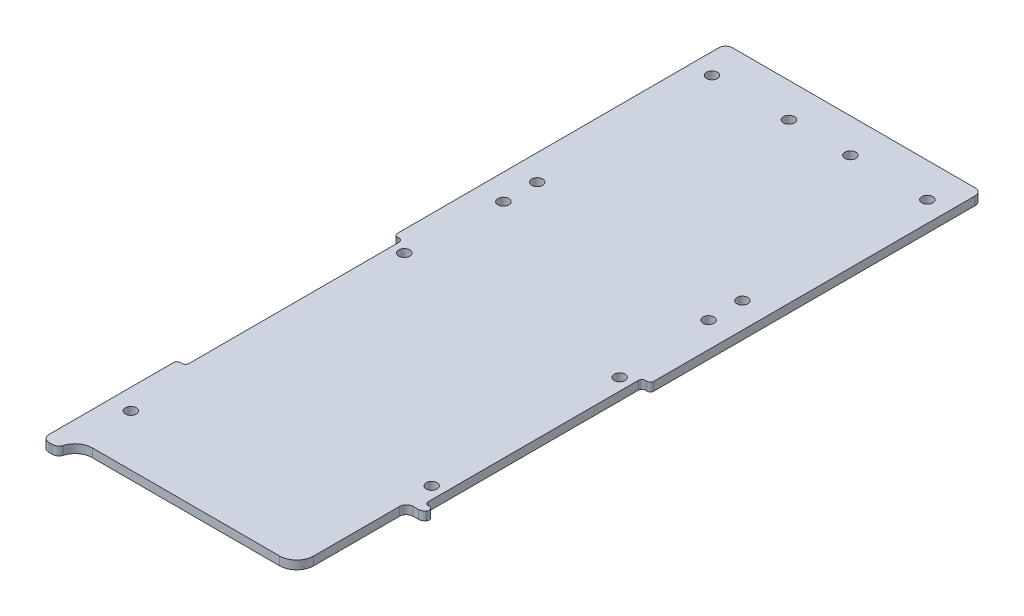
from build123d import *

# Parameters (mm, degrees)
SKETCH1_R               = 2.032
BOSS_EXTRUDE1_DEPTH     = 3.175
FILLET1_R               = 2.54
FILLET2_R               = 2.54
FILLET3_R               = 6.35
CUT_EXTRUDE1_DEPTH      = 136.673215063
FILLET4_R               = 6.35
FILLET5_R               = 2.54
SKETCH3_R               = 2.032
CUT_EXTRUDE2_DEPTH      = 136.673215063
CUT_EXTRUDE3_DEPTH      = 136.673215063
CUT_EXTRUDE3_DEPTH_BACK = 136.673215063
SKETCH4_W               = 3.175
SKETCH4_H               = 80.645
FILLET6_R               = 1.27


with BuildPart() as part:
    # Sketch1 → Boss-Extrude1 (new body)
    with BuildSketch(Plane(origin=(0, 0, 0), x_dir=(1, 0, 0), z_dir=(0, 1, 0))):
        Polygon((47.625, 127), (-47.625, 127), (-47.625, -127), (-41.275, -127), (-41.275, -120.65), (41.275, -120.65), (41.275, -127), (47.625, -127), align=None)
        with Locations((-39.999684148, -101.6)):
            Circle(SKETCH1_R, mode=Mode.SUBTRACT)
        with Locations((39.999684148, -69.85)):
            Circle(SKETCH1_R, mode=Mode.SUBTRACT)
        with Locations((-39.999684148, 0)):
            Circle(SKETCH1_R, mode=Mode.SUBTRACT)
        with Locations((-39.999684148, 114.3)):
            Circle(SKETCH1_R, mode=Mode.SUBTRACT)
        with Locations((-11.424684148, 114.3)):
            Circle(SKETCH1_R, mode=Mode.SUBTRACT)
        with Locations((39.999684148, 0)):
            Circle(SKETCH1_R, mode=Mode.SUBTRACT)
        with Locations((11.424684148, 114.3)):
            Circle(SKETCH1_R, mode=Mode.SUBTRACT)
        with Locations((39.999684148, 114.3)):
            Circle(SKETCH1_R, mode=Mode.SUBTRACT)
    extrude(amount=BOSS_EXTRUDE1_DEPTH)

    # Fillet1
    fillet1_edges = [part.edges().sort_by_distance(p)[0] for p in [
        (-47.625, 1.5875, -127),
        (47.625, 1.5875, -127),
        (47.625, 1.5875, 127),
        (-47.625, 1.5875, 127),
    ]]
    fillet(fillet1_edges, radius=FILLET1_R)

    # Fillet2
    fillet2_edges = [part.edges().sort_by_distance(p)[0] for p in [
        (41.275, 1.5875, 127),
        (-41.275, 1.5875, 127),
    ]]
    fillet(fillet2_edges, radius=FILLET2_R)

    # Fillet3
    fillet3_edges = [part.edges().sort_by_distance(p)[0] for p in [
        (41.275, 1.5875, 120.65),
        (-41.275, 1.5875, 120.65),
    ]]
    fillet(fillet3_edges, radius=FILLET3_R)

    # Sketch2 → Cut-Extrude1 (cut, through all)
    with BuildSketch(Plane.XZ):
        with BuildLine():
            Line((40.64508, 123.578690235), (40.64508, 79.88808))
            Line((40.64508, 79.88808), (47.625, 79.88808))
            Line((47.625, 79.88808), (47.625, 124.46))
            ThreePointArc((47.625, 124.46), (46.881051224, 126.256051224), (45.085, 127))
            Line((45.085, 127), (43.815, 127))
            ThreePointArc((43.815, 127), (42.297059666, 126.496530663), (41.380880287, 125.185714286))
            ThreePointArc((41.380880287, 125.185714286), (41.069166069, 124.356476684), (40.64508, 123.578690235))
        make_face()
    extrude(amount=-CUT_EXTRUDE1_DEPTH, mode=Mode.SUBTRACT)

    # Fillet4
    fillet4_edges = [part.edges().sort_by_distance(p)[0] for p in [
        (40.64508, 1.5875, 123.578690235),
    ]]
    fillet(fillet4_edges, radius=FILLET4_R)

    # Fillet5
    fillet5_edges = [part.edges().sort_by_distance(p)[0] for p in [
        (47.625, 1.5875, 79.88808),
        (40.64508, 1.5875, 79.88808),
    ]]
    fillet(fillet5_edges, radius=FILLET5_R)

    # Sketch3 → Cut-Extrude2 (cut, through all)
    with BuildSketch(Plane.XZ):
        with Locations((-38.106743812, -34.913768806)):
            Circle(SKETCH3_R)
        with Locations((-38.106743812, -47.490173279)):
            Circle(SKETCH3_R)
        with Locations((38.106743812, -47.490173279)):
            Circle(SKETCH3_R)
        with Locations((38.106743812, -34.913768806)):
            Circle(SKETCH3_R)
    extrude(amount=-CUT_EXTRUDE2_DEPTH, mode=Mode.SUBTRACT)

    # Sketch4 → Cut-Extrude3 (cut, two sides: drawn at the far end of the back side and taken through both)
    with BuildSketch(Plane(origin=(0, 3.175, 0), x_dir=(1, 0, 0), z_dir=(0, 1, 0)).offset(-CUT_EXTRUDE3_DEPTH_BACK)):
        with Locations((-46.0375, -36.5125)):
            Rectangle(SKETCH4_W, SKETCH4_H)
        with Locations((46.0375, -36.5125)):
            Rectangle(SKETCH4_W, SKETCH4_H)
    extrude(amount=CUT_EXTRUDE3_DEPTH + CUT_EXTRUDE3_DEPTH_BACK, mode=Mode.SUBTRACT)

    # Fillet6
    fillet6_edges = [part.edges().sort_by_distance(p)[0] for p in [
        (-44.45, 1.5875, -3.81),
        (-47.625, 1.5875, -3.81),
        (-47.625, 1.5875, 76.835),
        (-44.45, 1.5875, 76.835),
        (44.45, 1.5875, 76.835),
        (47.625, 1.5875, 76.835),
        (44.45, 1.5875, -3.81),
        (47.625, 1.5875, -3.81),
    ]]
    fillet(fillet6_edges, radius=FILLET6_R)


solid = part.part
